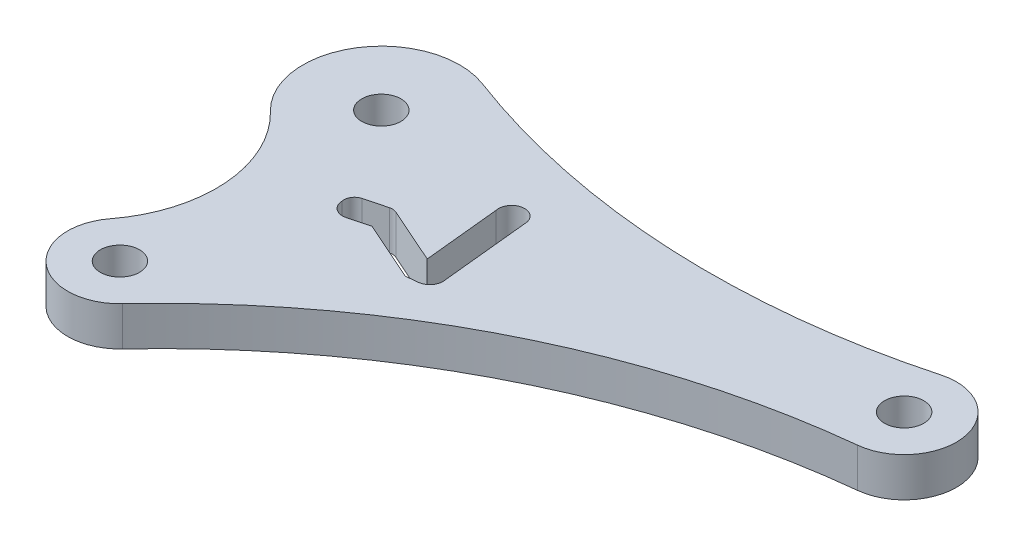
from build123d import *

# Parameters (mm, degrees)
SALIENTE_EXTRUIR1_OUTLINE_R = 1.5
SALIENTE_EXTRUIR1_DEPTH     = 3
S_LIDO_MOVER_COPIAR1_ANGLE  = 90


# Read off the part's stored shape, not the designer's step: Saliente-Extruir1
with BuildPart() as part:
    # Saliente-Extruir1 outline → Saliente-Extruir1 (new body)
    with BuildSketch(Plane.XY):
        with BuildLine():
            ThreePointArc((41771.487432324, -438.916733549), (41774.992492467, -434.200692189), (41770.014438295, -431.078918755))
            ThreePointArc((41770.014438295, -431.078918755), (41751.456517689, -433.102313751), (41733.174949659, -429.324111148))
            ThreePointArc((41733.174949659, -429.324111148), (41725.991842174, -431.730062122), (41726.889701646, -439.251995491))
            ThreePointArc((41726.889701646, -439.251995491), (41729.909074744, -445.69247761), (41727.882942515, -452.510924062))
            ThreePointArc((41727.882942515, -452.510924062), (41728.480324995, -457.995391332), (41733.987432324, -457.666733549))
            ThreePointArc((41733.987432324, -457.666733549), (41751.046402032, -444.909672965), (41771.487432324, -438.916733549))
        make_face()
        with Locations((41731.061313295, -454.939495491)):
            Circle(SALIENTE_EXTRUIR1_OUTLINE_R, mode=Mode.SUBTRACT)
        with BuildLine():
            Line((41738.411012413, -442.993278413), (41736.838856305, -443.404992792))
            ThreePointArc((41736.838856305, -443.404992792), (41735.982036246, -443.234989406), (41735.585699802, -442.456555601))
            ThreePointArc((41735.585699802, -442.456555601), (41735.69345686, -441.876829753), (41736.169165633, -441.52841218))
            Line((41736.169165633, -441.52841218), (41737.831630416, -441.093055392))
            ThreePointArc((41737.831630416, -441.093055392), (41738.100055673, -441.068468468), (41738.361410126, -441.134426674))
            Line((41738.361410126, -441.134426674), (41742.678233483, -443.044025097))
            Line((41742.678233483, -443.044025097), (41742.08574273, -437.173422628))
            ThreePointArc((41742.08574273, -437.173422628), (41742.914855043, -435.985031701), (41744.060436871, -436.872354922))
            Line((41744.060436871, -436.872354922), (41744.754133415, -443.73758562))
            ThreePointArc((41744.754133415, -443.73758562), (41744.580022463, -444.529990261), (41743.875600122, -444.932493559))
            Line((41743.875600122, -444.932493559), (41742.980225481, -445.023621226))
            Line((41742.980225481, -445.023621226), (41738.411012413, -442.993278413))
        make_face(mode=Mode.SUBTRACT)
        with Locations((41731.061313295, -434.939495491)):
            Circle(SALIENTE_EXTRUIR1_OUTLINE_R, mode=Mode.SUBTRACT)
        with Locations((41771.061313295, -434.939495491)):
            Circle(SALIENTE_EXTRUIR1_OUTLINE_R, mode=Mode.SUBTRACT)
    extrude(amount=SALIENTE_EXTRUIR1_DEPTH)


with BuildPart() as part_1:
    # Sólido-Mover/Copiar1: moved
    add(part.part.rotate(Axis((0, -443.939495491, 1.5), (-1, 0, 0)), S_LIDO_MOVER_COPIAR1_ANGLE))


solid = part_1.part
